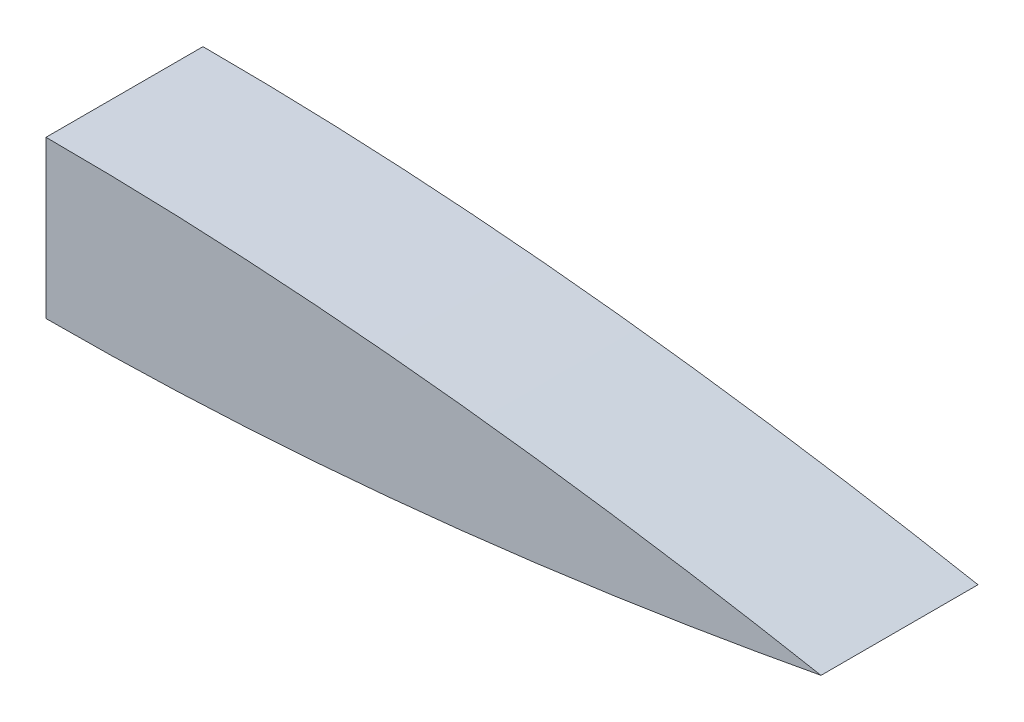
from build123d import *

# Parameters (mm, degrees)
BOSS_EXTRUDE2_DEPTH = 60


with BuildPart() as part:
    # Sketch2 → Boss-Extrude2 (new body)
    with BuildSketch(Plane(origin=(-7.4038e-05, 6.4e-08, -1164.264880538), x_dir=(0.999999999999998, 0, -6.359240732346129e-08), z_dir=(6.359240732346129e-08, -5.496117148058493e-11, 0.999999999999998))):
        with BuildLine():
            Line((-1.908e-06, -29.999999998), (-1.908e-06, 30.000000002))
            add(Edge.make_bspline(
                [(-1.908e-06, 30.000000002), (136.249000012, 30.000000002), (296.192746073, -6.4e-08)],
                knots=[0, 0, 0, 1, 1, 1], degree=2))
            add(Edge.make_bspline(
                [(-1.908e-06, -29.999999998), (136.249000012, -29.999999998), (296.192746073, -6.4e-08)],
                knots=[0, 0, 0, 1, 1, 1], degree=2))
        make_face()
    extrude(amount=-BOSS_EXTRUDE2_DEPTH)


solid = part.part
